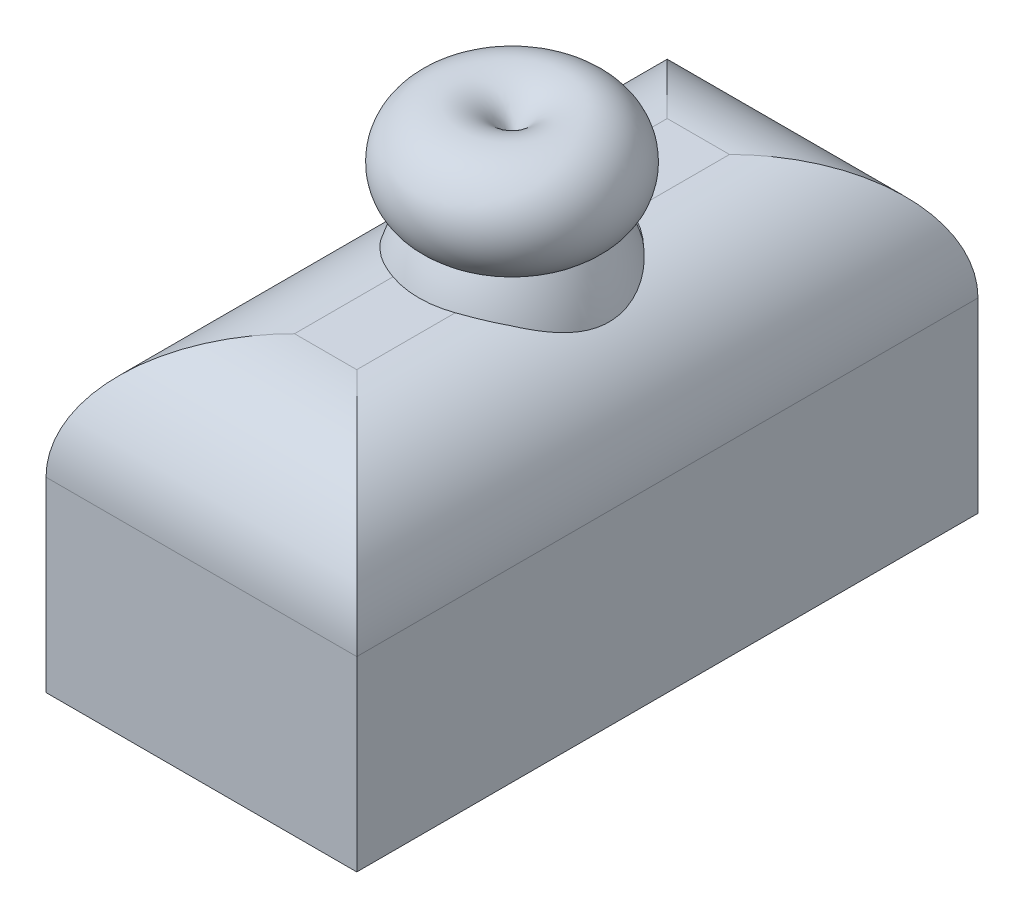
from build123d import *

# Parameters (mm, degrees)
BOSS_EXTRUDE1_DEPTH      = 25
BOSS_EXTRUDE1_DEPTH_BACK = 25
SKETCH2_W                = 25.012377578
SKETCH2_H                = 25.012377578
BOSS_EXTRUDE2_START      = -15
BOSS_EXTRUDE2_OUTLINE_R  = 7.5
BOSS_EXTRUDE2_DEPTH      = 15
FILLET1_R                = 10


# Read off the part's stored shape, not the designer's step: Boss-Extrude2
with BuildPart() as part:
    # Sketch2 → Boss-Extrude1 (new, two sides: drawn at the far end of the back side and taken through both)
    with BuildSketch(Plane.XY.offset(-BOSS_EXTRUDE1_DEPTH_BACK)):
        Rectangle(SKETCH2_W, SKETCH2_H)
    extrude(amount=BOSS_EXTRUDE1_DEPTH + BOSS_EXTRUDE1_DEPTH_BACK)

    # Boss-Extrude2 outline → Boss-Extrude2 (cut)
    with BuildSketch(Plane(origin=(0, 12.506188789, 0), x_dir=(1, 0, 0), z_dir=(0, 1, 0)).offset(BOSS_EXTRUDE2_START)):
        Circle(BOSS_EXTRUDE2_OUTLINE_R)
    extrude(amount=BOSS_EXTRUDE2_DEPTH, mode=Mode.SUBTRACT)

    # Fillet1
    # the kernel refuses this fillet: 10 mm, written as the material it takes off along each edge
    with BuildSketch(Plane(origin=(37.506188789, 12.506188789, 25), x_dir=(0, -1, 0), z_dir=(-1, 0, 0))) as fillet1_piece_1:
        with BuildLine():
            CenterArc((FILLET1_R, -FILLET1_R), FILLET1_R, 90, 90)
            Line((0, -FILLET1_R), (0, 0))
            Line((0, 0), (FILLET1_R, 0))
        make_face()
    extrude(amount=75.012377578, mode=Mode.SUBTRACT)
    with BuildSketch(Plane(origin=(37.506188789, 12.506188789, -25), x_dir=(0, -1, 0), z_dir=(-1, 0, 0))) as fillet1_piece_2:
        with BuildLine():
            CenterArc((FILLET1_R, FILLET1_R), FILLET1_R, 180, 90)
            Line((0, FILLET1_R), (0, 0))
            Line((0, 0), (FILLET1_R, 0))
        make_face()
    extrude(amount=75.012377578, mode=Mode.SUBTRACT)
    with BuildSketch(Plane(origin=(-12.506188789, 12.506188789, 50), x_dir=(0, -1, 0), z_dir=(0, 0, -1)), Plane(origin=(12.506188789, 12.506188789, -50), x_dir=(0, -1, 0), z_dir=(0, 0, 1))) as fillet1_piece_3:
        with BuildLine():
            CenterArc((FILLET1_R, -FILLET1_R), FILLET1_R, 90, 90)
            Line((0, -FILLET1_R), (0, 0))
            Line((0, 0), (FILLET1_R, 0))
        make_face()
    extrude(amount=100, mode=Mode.SUBTRACT)

    # Sketch4 → Revolve1 (revolve)
    with BuildSketch(Plane(origin=(0, 0, 0), x_dir=(0, 0, -1), z_dir=(1, 0, 0))):
        with BuildLine():
            Line((0, -5.814560752), (0, 18.466451154))
            ThreePointArc((0, 18.466451154), (-6.262360981, 21.865939811), (-6.402172987, 14.741745766))
            ThreePointArc((-6.402172987, 14.741745766), (-7.512812881, 3.120723924), (0, -5.814560752))
        make_face()
    revolve(axis=Axis((0, -5.814560752, 0), (0, 1, 0)))


solid = part.part
